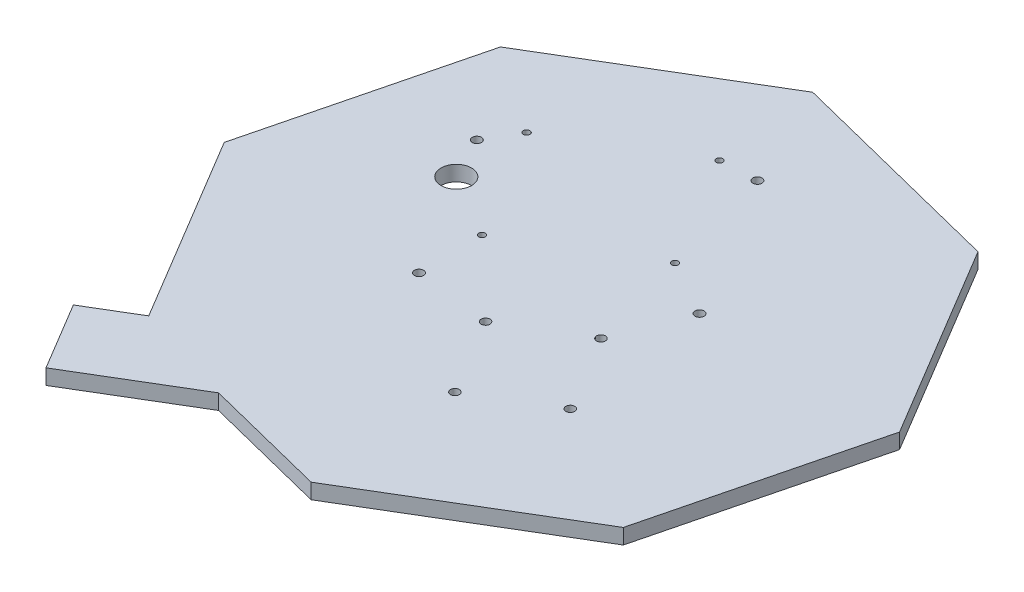
from build123d import *

# Parameters (mm, degrees)
BOSS_EXTRUDE2_DEPTH = 6.35
BOSS_EXTRUDE3_DEPTH = 6.35
SKETCH3_R           = 1.3716
CUT_EXTRUDE1_DEPTH  = 184.327942683
SKETCH4_R           = 6.35
CUT_EXTRUDE2_DEPTH  = 184.327942683
SKETCH5_R           = 1.905
CUT_EXTRUDE3_DEPTH  = 184.327942683
SKETCH7_R           = 1.85
CUT_EXTRUDE4_DEPTH  = 184.327942683


with BuildPart() as part:
    # Sketch1 → Boss-Extrude2 (new body)
    with BuildSketch(Plane(origin=(0, 0, 0), x_dir=(1, 0, 0), z_dir=(0, 1, 0))):
        Polygon((73.764977758, 99.321348004), (-18.071082704, 122.390514677), (-99.321348004, 73.764977758), (-122.390514677, -18.071082704), (-73.764977758, -99.321348004), (18.071082704, -122.390514677), (99.321348004, -73.764977758), (122.390514677, 18.071082704), align=None)
    extrude(amount=BOSS_EXTRUDE2_DEPTH)

    # Sketch2 → Boss-Extrude3 (add)
    with BuildSketch(Plane(origin=(0, 6.35, 0), x_dir=(-1, 0, 0), z_dir=(0, 1, 0))):
        Polygon((75.591082235, 96.270040344), (95.206631479, 108.009283415), (78.249947043, 136.342854545), (33.35213433, 109.473031516), (73.764977758, 99.321348004), align=None)
    extrude(amount=-BOSS_EXTRUDE3_DEPTH)

    # Sketch3 → Cut-Extrude1 (cut, through all)
    with BuildSketch(Plane.XZ):
        with Locations((-63.056087654, -48.387784923)):
            Circle(SKETCH3_R)
        with Locations((-35.416692023, -2.204063982)):
            Circle(SKETCH3_R)
        with Locations((14.794755029, -32.253917523)):
            Circle(SKETCH3_R)
        with Locations((-12.844640601, -78.437638464)):
            Circle(SKETCH3_R)
    extrude(amount=-CUT_EXTRUDE1_DEPTH, mode=Mode.SUBTRACT)

    # Sketch4 → Cut-Extrude2 (cut, through all)
    with BuildSketch(Plane.XZ):
        with Locations((-61.737440704, -17.814468138)):
            Circle(SKETCH4_R)
    extrude(amount=-CUT_EXTRUDE2_DEPTH, mode=Mode.SUBTRACT)

    # Sketch5 → Cut-Extrude3 (cut, through all)
    with BuildSketch(Plane.XZ):
        with Locations((2.267257691, -79.060054342)):
            Circle(SKETCH5_R)
        with Locations((-70.746175604, -35.363982912)):
            Circle(SKETCH5_R)
        with Locations((38.137167074, -19.123653876)):
            Circle(SKETCH5_R)
        with Locations((-34.876266221, 24.572417555)):
            Circle(SKETCH5_R)
    extrude(amount=-CUT_EXTRUDE3_DEPTH, mode=Mode.SUBTRACT)

    # Sketch7 → Cut-Extrude4 (cut, through all)
    with BuildSketch(Plane(origin=(0, 6.35, 0), x_dir=(1, 0, 0), z_dir=(0, 1, 0))):
        with Locations((15.538619902, -60.042079341)):
            Circle(SKETCH7_R)
        with Locations((-3.461904754, -28.29337759)):
            Circle(SKETCH7_R)
        with Locations((26.570650956, -10.319908322)):
            Circle(SKETCH7_R)
        with Locations((45.571175611, -42.068610072)):
            Circle(SKETCH7_R)
    extrude(amount=-CUT_EXTRUDE4_DEPTH, mode=Mode.SUBTRACT)


solid = part.part
